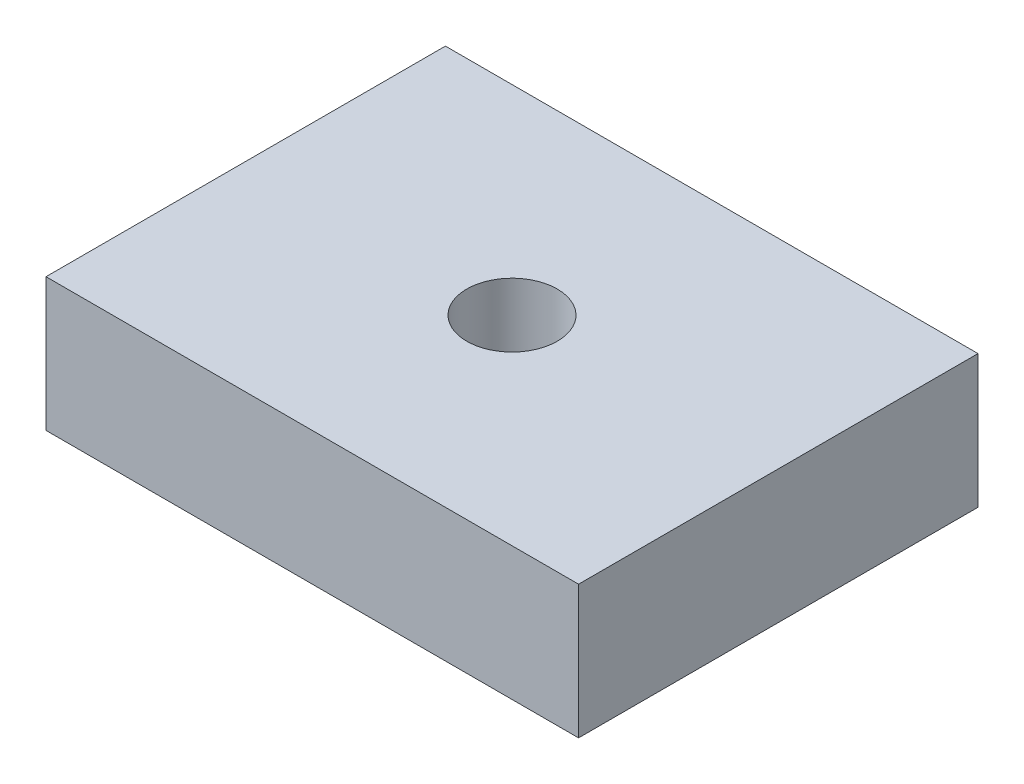
from build123d import *

# Parameters (mm, degrees)
SKETCH1_W                                       = 20
SKETCH1_H                                       = 15
BOSS_EXTRUDE1_DEPTH                             = 5
CSK_FOR_M3_FLAT_HEAD_MACHINE_SCREW1_D           = 3.4
CSK_FOR_M3_FLAT_HEAD_MACHINE_SCREW1_CSINK_D     = 6.3
CSK_FOR_M3_FLAT_HEAD_MACHINE_SCREW1_CSINK_ANGLE = 90


with BuildPart() as part:
    # Sketch1 → Boss-Extrude1 (new body)
    with BuildSketch(Plane(origin=(0, 0, 0), x_dir=(1, 0, 0), z_dir=(0, 1, 0))):
        with Locations((10, 7.5)):
            Rectangle(SKETCH1_W, SKETCH1_H)
    extrude(amount=BOSS_EXTRUDE1_DEPTH)

    # CSK for M3 Flat Head Machine Screw1 (through all)
    with Locations(Plane(origin=(10, 0, -7.5), x_dir=(0, 0, -1), z_dir=(0, -1, 0))):
        with Locations((0, 0)):
            CounterSinkHole(CSK_FOR_M3_FLAT_HEAD_MACHINE_SCREW1_D / 2, CSK_FOR_M3_FLAT_HEAD_MACHINE_SCREW1_CSINK_D / 2, counter_sink_angle=CSK_FOR_M3_FLAT_HEAD_MACHINE_SCREW1_CSINK_ANGLE)


solid = part.part
